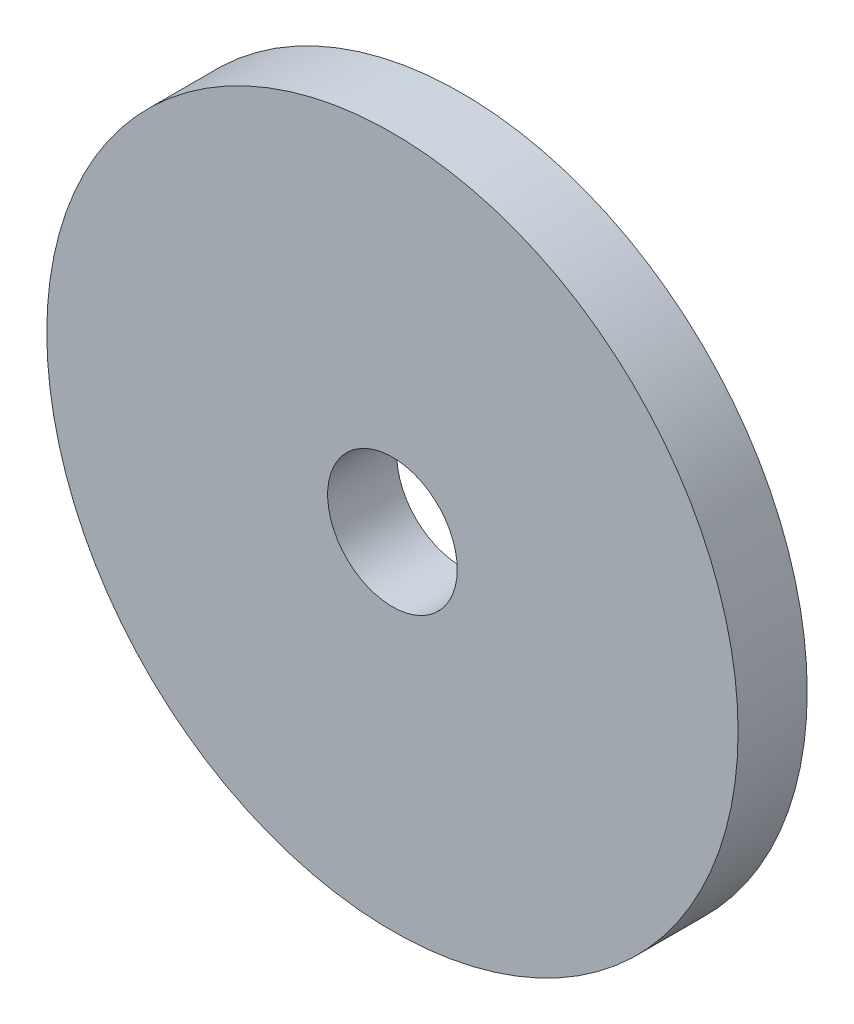
from build123d import *

# Parameters (mm, degrees)
SKETCH1_R           = 12.7
SKETCH1_R_2         = 2.38125
BOSS_EXTRUDE1_DEPTH = 2.54


with BuildPart() as part:
    # Sketch1 → Boss-Extrude1 (new body)
    with BuildSketch(Plane.XY):
        Circle(SKETCH1_R)
        Circle(SKETCH1_R_2, mode=Mode.SUBTRACT)
    extrude(amount=BOSS_EXTRUDE1_DEPTH)


solid = part.part
